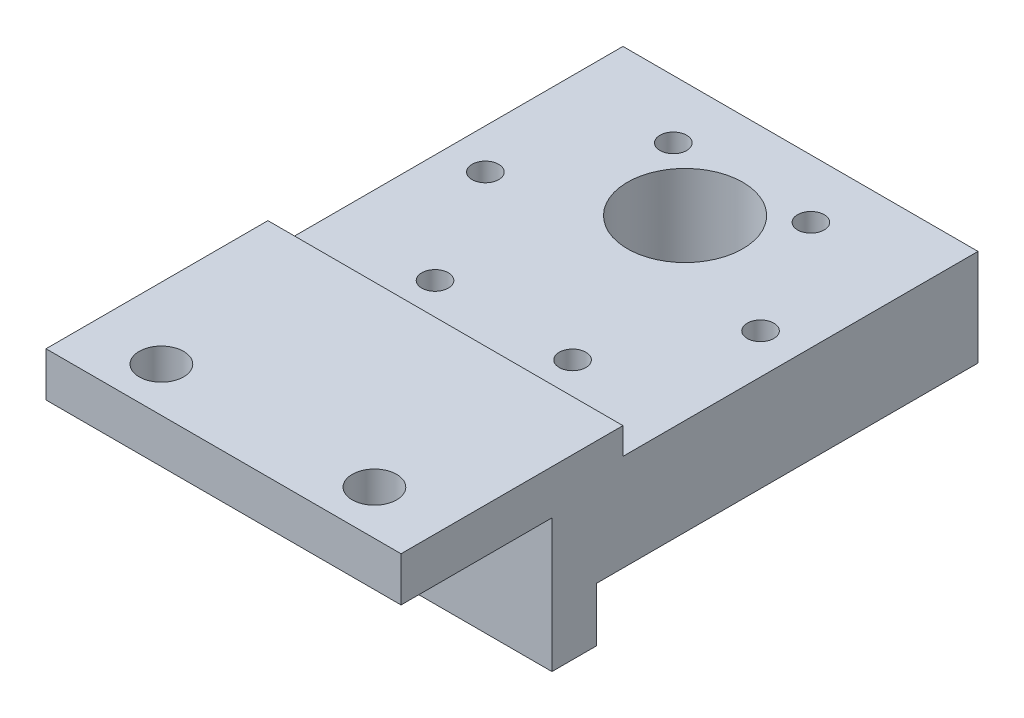
from build123d import *

# Parameters (mm, degrees)
SKETCH3_W               = 40
SKETCH3_H               = 65
BOSS_EXTRUDE1_DEPTH     = 5
SKETCH8_W               = 40
SKETCH8_H               = 43
BOSS_EXTRUDE3_DEPTH     = 8.9
CUT_EXTRUDE3_DEPTH      = 51.042082291
CUT_EXTRUDE3_DEPTH_BACK = 51.042082291
SKETCH1_R               = 1.5
SKETCH1_R_2             = 6.5
SKETCH6_R               = 2.5
CUT_EXTRUDE6_DEPTH      = 52.168447309
SKETCH7_W               = 40
SKETCH7_H               = 5
BOSS_EXTRUDE2_DEPTH     = 15
SKETCH9_W               = 40
SKETCH9_H               = 3
CUT_EXTRUDE7_DEPTH      = 63.04836823


with BuildPart() as part:
    # Sketch3 → Boss-Extrude1 (new body)
    with BuildSketch(Plane(origin=(0, 0, 0), x_dir=(1, 0, 0), z_dir=(0, 1, 0))):
        with Locations((0, -12.5)):
            Rectangle(SKETCH3_W, SKETCH3_H)
    extrude(amount=BOSS_EXTRUDE1_DEPTH)

    # Sketch8 → Boss-Extrude3 (add)
    with BuildSketch(Plane.XZ):
        with Locations((0, 1.5)):
            Rectangle(SKETCH8_W, SKETCH8_H)
    extrude(amount=BOSS_EXTRUDE3_DEPTH)

    # Sketch1 → Cut-Extrude3 (cut, two sides: drawn at the far end of the back side and taken through both)
    with BuildSketch(Plane(origin=(0, 0, 0), x_dir=(1, 0, 0), z_dir=(0, 1, 0)).offset(-CUT_EXTRUDE3_DEPTH_BACK)):
        with Locations((-15.5, 0)):
            Circle(SKETCH1_R)
        with Locations((-7.75, 13.423393759)):
            Circle(SKETCH1_R)
        with Locations((7.75, 13.423393759)):
            Circle(SKETCH1_R)
        with Locations((15.5, 0)):
            Circle(SKETCH1_R)
        with Locations((7.75, -13.423393759)):
            Circle(SKETCH1_R)
        with Locations((-7.75, -13.423393759)):
            Circle(SKETCH1_R)
        with Locations((0, 7)):
            Circle(SKETCH1_R_2)
    extrude(amount=CUT_EXTRUDE3_DEPTH + CUT_EXTRUDE3_DEPTH_BACK, mode=Mode.SUBTRACT)

    # Sketch6 → Cut-Extrude6 (cut, through all)
    with BuildSketch(Plane(origin=(0, 5, 0), x_dir=(1, 0, 0), z_dir=(0, 1, 0))):
        with Locations((-12, -40)):
            Circle(SKETCH6_R)
        with Locations((12, -40)):
            Circle(SKETCH6_R)
    extrude(amount=-CUT_EXTRUDE6_DEPTH, mode=Mode.SUBTRACT)

    # Sketch7 → Boss-Extrude2 (add)
    with BuildSketch(Plane.XZ):
        with Locations((0, 25.5)):
            Rectangle(SKETCH7_W, SKETCH7_H)
    extrude(amount=BOSS_EXTRUDE2_DEPTH)

    # Sketch9 → Cut-Extrude7 (cut, through all)
    with BuildSketch(Plane.ZY.offset(20)):
        with Locations((0, 3.5)):
            Rectangle(SKETCH9_W, SKETCH9_H)
    extrude(amount=-CUT_EXTRUDE7_DEPTH, mode=Mode.SUBTRACT)


solid = part.part
